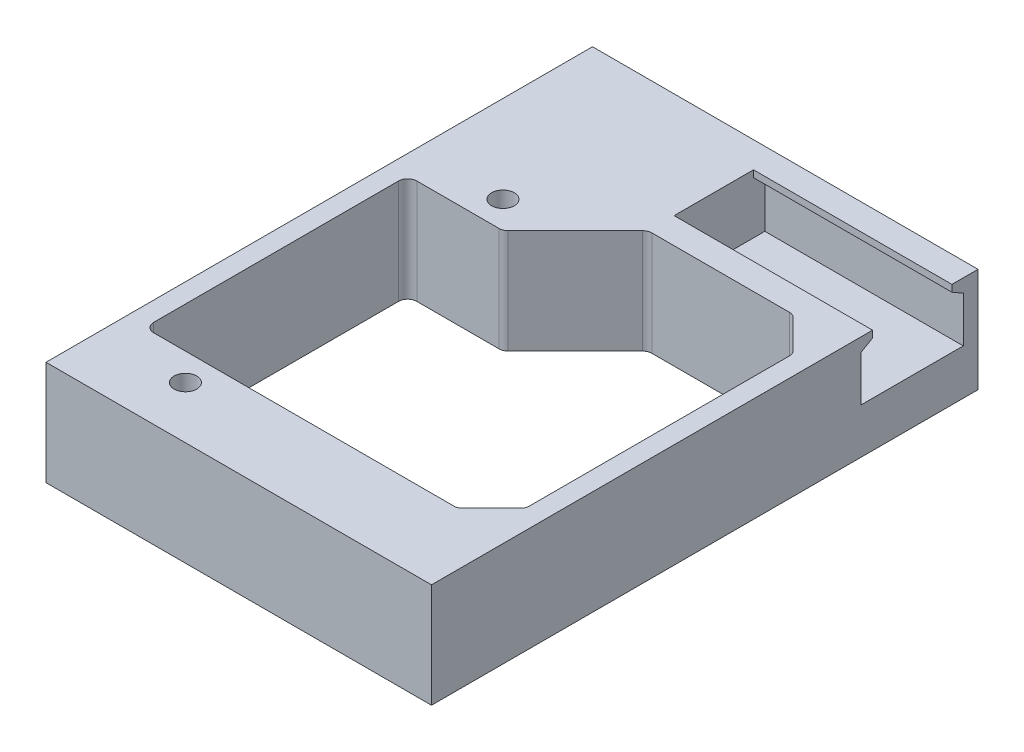
from build123d import *

# Parameters (mm, degrees)
BOSS_EXTRUDE1_START      = -1
SKETCH1_W                = 1.7
SKETCH1_H                = 89.2
BOSS_EXTRUDE1_DEPTH      = 9.2
SKETCH4_W                = 33.7
SKETCH4_H                = 11.6
BOSS_EXTRUDE3_DEPTH      = 9.2
SERVO_HOLDER_DEPTH       = 1
SERVO_HOLDER_DEPTH_BACK  = 9.2
SKETCH3_W                = 14
SKETCH3_H                = 7
SKETCH3_R                = 1
SKETCH37_W               = 20
SKETCH37_H               = 7
BOSS_EXTRUDE19_DEPTH     = 10.2
CUT_EXTRUDE10_DEPTH      = 93.482268571
CUT_EXTRUDE10_DEPTH_BACK = 93.482268571
SKETCH29_W               = 34.409909993
SKETCH29_H               = 5.977389624
BOSS_EXTRUDE13_START     = 2
SKETCH30_W               = 34
SKETCH30_H               = 38
SKETCH30_R               = 1.6
BOSS_EXTRUDE13_DEPTH     = 6.5
SKETCH41_W               = 17.288461538
SKETCH41_H               = 9.2
CUT_EXTRUDE14_DEPTH      = 15
BOSS_EXTRUDE14_START     = -38
SKETCH32_R               = 1.45
SKETCH32_R_2             = 5
BOSS_EXTRUDE14_DEPTH     = 8.8
BOSS_EXTRUDE16_DEPTH     = 3
BOSS_EXTRUDE17_DEPTH     = 3
BOSS_EXTRUDE18_START     = -9.2
BOSS_EXTRUDE18_DEPTH     = 9.2
SKETCH39_W               = 1.7
SKETCH39_H               = 41.2
BOSS_EXTRUDE20_DEPTH     = 9.2
CUT_EXTRUDE13_DEPTH      = 17.5
CHAMFER2_SIZE            = 0.6
CHAMFER2_SIZE_2          = 1.039230485
CHAMFER3_SIZE            = 3
FILLET10_R               = 6
CUT_EXTRUDE15_DEPTH      = 10
CHAMFER4_SIZE            = 2.5
CUT_EXTRUDE16_DEPTH      = 10
FILLET11_R               = 0.8
SKETCH44_W               = 59.192885725
SKETCH44_H               = 45.417181718
CUT_EXTRUDE17_DEPTH      = 87.948983376


with BuildPart() as part:
    # Sketch1 → Boss-Extrude1 (new body)
    with BuildSketch(Plane(origin=(0, 0, 0), x_dir=(1, 0, 0), z_dir=(0, 1, 0)).offset(BOSS_EXTRUDE1_START)):
        with Locations((-20.85, 25.311538462)):
            Rectangle(SKETCH1_W, SKETCH1_H)
    extrude(amount=-BOSS_EXTRUDE1_DEPTH)

    # Sketch4 → Boss-Extrude3 (add)
    with BuildSketch(Plane.XZ.offset(10.2)):
        with Locations((-4.85, -64.111538462)):
            Rectangle(SKETCH4_W, SKETCH4_H)
    extrude(amount=-BOSS_EXTRUDE3_DEPTH)

    # Sketch3 → Servo Holder (add, two sides: drawn at the far end of the back side and taken through both)
    # profile 1 of 2: a face of its own
    with BuildSketch(Plane.XZ.offset(10.2).offset(-SERVO_HOLDER_DEPTH_BACK)):
        with Locations((-14.7, -55.411538462)):
            Rectangle(SKETCH3_W, SKETCH3_H)
        with Locations(Location((-14, -54.311538462, 0), (0, 0, 270))):
            Circle(SKETCH3_R, mode=Mode.SUBTRACT)
    # profile 2 of 2: a face of its own
    with BuildSketch(Plane.XZ.offset(10.2).offset(-SERVO_HOLDER_DEPTH_BACK)):
        with Locations((-14.7, -25.211538462)):
            Rectangle(SKETCH3_W, SKETCH3_H)
        with Locations(Location((-14, -26.311538462, 0), (0, 0, 90))):
            Circle(SKETCH3_R, mode=Mode.SUBTRACT)
    extrude(amount=SERVO_HOLDER_DEPTH + SERVO_HOLDER_DEPTH_BACK)

    # Sketch37 → Boss-Extrude19 (add)
    with BuildSketch(Plane(origin=(0, -1, 0), x_dir=(1, 0, 0), z_dir=(0, 1, 0))):
        with Locations((2.3, 25.211538462)):
            Rectangle(SKETCH37_W, SKETCH37_H)
    extrude(amount=-BOSS_EXTRUDE19_DEPTH)

    # Sketch29 → Cut-Extrude10 (cut, two sides: drawn at the far end of the back side and taken through both)
    with BuildSketch(Plane(origin=(0, 0, -69.911538462), x_dir=(-1, 0, 0), z_dir=(0, 0, -1)).offset(-CUT_EXTRUDE10_DEPTH_BACK)):
        with Locations((4.495045004, -13.188694812)):
            Rectangle(SKETCH29_W, SKETCH29_H)
    extrude(amount=CUT_EXTRUDE10_DEPTH + CUT_EXTRUDE10_DEPTH_BACK, mode=Mode.SUBTRACT)


with BuildPart() as body_2:
    # Sketch30 → Boss-Extrude13 (new body)
    with BuildSketch(Plane.XY.offset(BOSS_EXTRUDE13_START)):
        with Locations((-4.7, -20)):
            Rectangle(SKETCH30_W, SKETCH30_H)
        with Locations(Location((5.3, -34, 0), (0, 0, 180))):
            Circle(SKETCH30_R, mode=Mode.SUBTRACT)
        with Locations(Location((5.3, -19, 0), (0, 0, 180))):
            Circle(SKETCH30_R, mode=Mode.SUBTRACT)
        with Locations(Location((-14.7, -34, 0), (0, 0, 180))):
            Circle(SKETCH30_R, mode=Mode.SUBTRACT)
        with Locations(Location((-14.7, -19, 0), (0, 0, 180))):
            Circle(SKETCH30_R, mode=Mode.SUBTRACT)
    extrude(amount=BOSS_EXTRUDE13_DEPTH)


with BuildPart() as cut_extrude14_tool:
    # Sketch41 → Cut-Extrude14 (new body)
    with BuildSketch(Plane(origin=(-20, 0, 0), x_dir=(0, 0, -1), z_dir=(1, 0, 0))):
        with Locations((-10.644230769, -5.6)):
            Rectangle(SKETCH41_W, SKETCH41_H)
    extrude(amount=-CUT_EXTRUDE14_DEPTH)


with BuildPart() as part_1:
    add(part.part)

    # Cut-Extrude14: cut by cut_extrude14_tool
    add(cut_extrude14_tool.part, mode=Mode.SUBTRACT)



with BuildPart() as body_2_1:
    add(body_2.part)

    # Cut-Extrude14: cut by cut_extrude14_tool
    add(cut_extrude14_tool.part, mode=Mode.SUBTRACT)

    # Sketch32 → Boss-Extrude14 (add)
    with BuildSketch(Plane.XZ.offset(39).offset(BOSS_EXTRUDE14_START)):
        with BuildLine():
            ThreePointArc((11.872921748, 2), (25.925390485, -3.535644523), (35.05, 8.5))
            ThreePointArc((35.05, 8.5), (22.55, 21), (10.05, 8.5))
            Line((10.05, 8.5), (12.3, 8.5))
            Line((12.3, 8.5), (12.3, 2))
            Line((12.3, 2), (11.872921748, 2))
        make_face()
        with Locations(Location((15.25884337, 2.409923235, 0), (0, 0, 180))):
            Circle(SKETCH32_R, mode=Mode.SUBTRACT)
        with Locations(Location((28.640076765, 1.20884337, 0), (0, 0, 180))):
            Circle(SKETCH32_R, mode=Mode.SUBTRACT)
        with Locations(Location((16.459923235, 15.79115663, 0), (0, 0, 180))):
            Circle(SKETCH32_R, mode=Mode.SUBTRACT)
        with Locations(Location((22.55, 8.5, 0), (0, 0, 180))):
            Circle(SKETCH32_R_2, mode=Mode.SUBTRACT)
        with Locations(Location((29.84115663, 14.590076765, 0), (0, 0, 180))):
            Circle(SKETCH32_R, mode=Mode.SUBTRACT)
    extrude(amount=BOSS_EXTRUDE14_DEPTH)


with BuildPart() as part_2:
    add(part_1.part)

    add(body_2_1.part)  # Boss-Extrude16 merges body 2
    # Sketch34 → Boss-Extrude16 (add)
    with BuildSketch(Plane.ZY.offset(21.7)):
        Polygon((-21.711538462, -1), (-21.711538462, -9.8), (2, -39), (8.5, -39), (8.5, -1), align=None)
    extrude(amount=-BOSS_EXTRUDE16_DEPTH)

    # Sketch35 → Boss-Extrude17 (add)
    with BuildSketch(Plane(origin=(12.3, 0, 0), x_dir=(0, 0, -1), z_dir=(1, 0, 0))):
        Polygon((-2, -1), (21.711538462, -1), (21.711538462, -9.8), (-2, -39), (-8.5, -39), (-8.5, -9.8), (-8.5, -1), align=None)
    extrude(amount=-BOSS_EXTRUDE17_DEPTH)

    # Sketch36 → Boss-Extrude18 (add)
    with BuildSketch(Plane.XZ.offset(10.2).offset(BOSS_EXTRUDE18_START)):
        Polygon((12.3, -10.579162849), (16.63422252, -2.511520186), (12.3, 1.345455989), align=None)
    extrude(amount=BOSS_EXTRUDE18_DEPTH)

    # Sketch39 → Boss-Extrude20 (add)
    with BuildSketch(Plane(origin=(0, -1, 0), x_dir=(1, 0, 0), z_dir=(0, 1, 0))):
        with Locations((11.45, 49.311538462)):
            Rectangle(SKETCH39_W, SKETCH39_H)
    extrude(amount=-BOSS_EXTRUDE20_DEPTH)

    # Sketch40 → Cut-Extrude13 (cut)
    with BuildSketch(Plane(origin=(12.3, 0, 0), x_dir=(0, 0, -1), z_dir=(1, 0, 0))):
        Polygon((64.111538462, -1), (60.611538462, -1), (60.611538462, -2.2), (59.611538462, -2.2), (59.611538462, -6.2), (64.111538462, -6.2), align=None)
        Polygon((67.611538462, -1), (64.111538462, -1), (64.111538462, -6.2), (68.611538462, -6.2), (68.611538462, -2.2), (67.611538462, -2.2), align=None)
    extrude(amount=-CUT_EXTRUDE13_DEPTH, mode=Mode.SUBTRACT)

    # Chamfer2
    # the kernel refuses this chamfer: 1.039230485, 0.6 mm, written as the material it takes off along each edge
    with BuildSketch(Plane(origin=(14.988578382, -2.2, -67.611538462), x_dir=(0, 0.9983227437537925, 0.05789386240267319), z_dir=(-1, 0, 0))) as chamfer2_piece_1_section:
        Polygon((CHAMFER2_SIZE * 0.998322743754, CHAMFER2_SIZE * 0.0578938624027), (-CHAMFER2_SIZE_2 * 0.0578938623771, CHAMFER2_SIZE_2 * 0.998322743313), (0, 0), align=None)
    chamfer2_piece_1 = extrude(amount=20.188578382, mode=Mode.PRIVATE)
    chamfer2_piece_1 = split(chamfer2_piece_1, bisect_by=Plane(origin=(4.894289191, -2.005782009, -68.611538462), z_dir=(0, 0, 1)), keep=Keep.TOP, mode=Mode.PRIVATE)
    add(chamfer2_piece_1, mode=Mode.SUBTRACT)
    with BuildSketch(Plane(origin=(14.988578382, -2.2, -60.611538462), x_dir=(0, 0.9983227437537925, -0.05789386240267317), z_dir=(-1, 0, 0))) as chamfer2_piece_2_section:
        Polygon((CHAMFER2_SIZE * 0.998322743754, -CHAMFER2_SIZE * 0.0578938624027), (-CHAMFER2_SIZE_2 * 0.0578938623771, -CHAMFER2_SIZE_2 * 0.998322743313), (0, 0), align=None)
    chamfer2_piece_2 = extrude(amount=20.188578382, mode=Mode.PRIVATE)
    chamfer2_piece_2 = split(chamfer2_piece_2, bisect_by=Plane(origin=(4.894289191, -2.005782009, -59.611538462), z_dir=(0, 0, -1)), keep=Keep.TOP, mode=Mode.PRIVATE)
    add(chamfer2_piece_2, mode=Mode.SUBTRACT)

    # Chamfer3
    chamfer3_edges = [part_2.edges().sort_by_distance(p)[0] for p in [
        (10.6, -5.6, -58.311538462),
        (10.6, -5.6, -28.711538462),
    ]]
    chamfer(chamfer3_edges, length=CHAMFER3_SIZE)

    # Fillet10
    fillet10_edges = [part_2.edges().sort_by_distance(p)[0] for p in [
        (16.63422252, -5.4, -2.511520186),
        (12.3, -5.6, -10.579162849),
    ]]
    fillet(fillet10_edges, radius=FILLET10_R)

    # Sketch42 → Cut-Extrude15 (cut)
    with BuildSketch(Plane.XY.offset(8.5)):
        with BuildLine():
            Line((-1.1, -1), (-1.1, -10.6))
            ThreePointArc((-1.1, -10.6), (-4.7, -14.2), (-8.3, -10.6))
            Line((-8.3, -10.6), (-8.3, -1))
            Line((-8.3, -1), (-1.1, -1))
        make_face()
    extrude(amount=-CUT_EXTRUDE15_DEPTH, mode=Mode.SUBTRACT)

    # Chamfer4
    chamfer4_edges = [part_2.edges().sort_by_distance(p)[0] for p in [
        (-7.7, -5.6, -58.311538462),
    ]]
    chamfer(chamfer4_edges, length=CHAMFER4_SIZE)

    # Sketch43 → Cut-Extrude16 (cut)
    with BuildSketch(Plane(origin=(0, -1, 0), x_dir=(1, 0, 0), z_dir=(0, 1, 0))):
        Polygon((-5.2, 58.311538462), (-11.6, 51.911538462), (-5.2, 51.911538462), align=None)
    extrude(amount=-CUT_EXTRUDE16_DEPTH, mode=Mode.SUBTRACT)

    # Fillet11
    fillet11_edges = [part_2.edges().sort_by_distance(p)[0] for p in [
        (-20, -5.6, -28.711538462),
        (-20, -5.6, -51.911538462),
        (10.6, -5.6, -55.311538462),
        (10.6, -5.6, -31.711538462),
        (7.6, -5.6, -28.711538462),
        (7.6, -5.6, -58.311538462),
        (-5.2, -5.6, -58.311538462),
        (-11.6, -5.6, -51.911538462),
    ]]
    fillet(fillet11_edges, radius=FILLET11_R)

    # Sketch44 → Cut-Extrude17 (cut, through all)
    with BuildSketch(Plane(origin=(0, -1, 0), x_dir=(1, 0, 0), z_dir=(0, 1, 0))):
        with Locations((7.896442862, -0.997052397)):
            Rectangle(SKETCH44_W, SKETCH44_H)
    extrude(amount=-CUT_EXTRUDE17_DEPTH, mode=Mode.SUBTRACT)


solid = part_2.part
